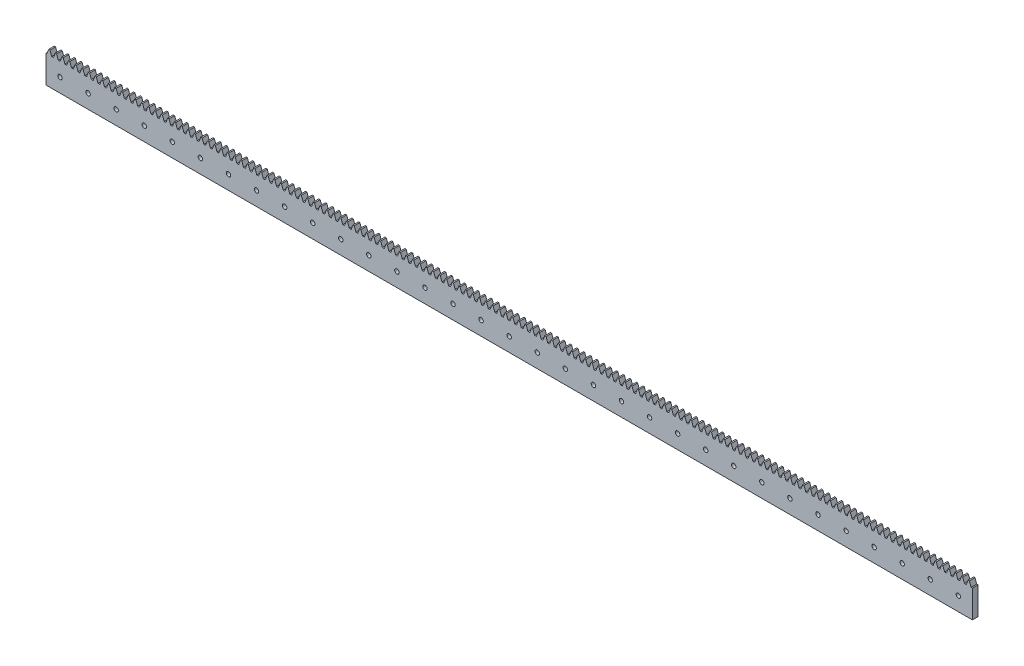
from build123d import *

# Parameters (mm, degrees)
BLANKSKE_W          = 660
BLANKSKE_H          = 23
BLANK_DEPTH         = 4
TOOTHCUTSIM_DEPTH   = 661.412749726
TEETHCUTS_COUNT     = 142
TEETHCUTS_PITCH     = 4.712388975
SKETCH_2_R          = 1.575
CUT_EXTRUDE_2_DEPTH = 661.412749726


with BuildPart() as part:
    # BlankSke → Blank (new body)
    with BuildSketch(Plane.XY):
        with Locations((330, 11.5)):
            Rectangle(BLANKSKE_W, BLANKSKE_H)
    extrude(amount=-BLANK_DEPTH)

    # TooCutSkeSim → ToothCutSim (cut, through all)
    with BuildSketch(Plane.XY):
        Polygon((0.654653055, 19.625), (-0.654653055, 19.625), (-1.892297439, 23.0254), (1.892297439, 23.0254), align=None)
    toothcutsim = extrude(amount=-TOOTHCUTSIM_DEPTH, mode=Mode.SUBTRACT)

    # TeethCuts: ToothCutSim ×142
    with Locations(*[(i * TEETHCUTS_PITCH, 0, 0) for i in range(1, TEETHCUTS_COUNT)]):
        add(toothcutsim, mode=Mode.SUBTRACT)

    # 草图2 → 切除-拉伸2 (cut, through all)
    with BuildSketch(Plane.XY):
        with Locations((650, 10)):
            Circle(SKETCH_2_R)
        with Locations((630, 10)):
            Circle(SKETCH_2_R)
        with Locations((610, 10)):
            Circle(SKETCH_2_R)
        with Locations((590, 10)):
            Circle(SKETCH_2_R)
        with Locations((570, 10)):
            Circle(SKETCH_2_R)
        with Locations((550, 10)):
            Circle(SKETCH_2_R)
        with Locations((530, 10)):
            Circle(SKETCH_2_R)
        with Locations((510, 10)):
            Circle(SKETCH_2_R)
        with Locations((490, 10)):
            Circle(SKETCH_2_R)
        with Locations((470, 10)):
            Circle(SKETCH_2_R)
        with Locations((450, 10)):
            Circle(SKETCH_2_R)
        with Locations((430, 10)):
            Circle(SKETCH_2_R)
        with Locations((410, 10)):
            Circle(SKETCH_2_R)
        with Locations((390, 10)):
            Circle(SKETCH_2_R)
        with Locations((370, 10)):
            Circle(SKETCH_2_R)
        with Locations((350, 10)):
            Circle(SKETCH_2_R)
        with Locations((330, 10)):
            Circle(SKETCH_2_R)
        with Locations((310, 10)):
            Circle(SKETCH_2_R)
        with Locations((290, 10)):
            Circle(SKETCH_2_R)
        with Locations((270, 10)):
            Circle(SKETCH_2_R)
        with Locations((250, 10)):
            Circle(SKETCH_2_R)
        with Locations((230, 10)):
            Circle(SKETCH_2_R)
        with Locations((210, 10)):
            Circle(SKETCH_2_R)
        with Locations((190, 10)):
            Circle(SKETCH_2_R)
        with Locations((170, 10)):
            Circle(SKETCH_2_R)
        with Locations((150, 10)):
            Circle(SKETCH_2_R)
        with Locations((130, 10)):
            Circle(SKETCH_2_R)
        with Locations((110, 10)):
            Circle(SKETCH_2_R)
        with Locations((90, 10)):
            Circle(SKETCH_2_R)
        with Locations((70, 10)):
            Circle(SKETCH_2_R)
        with Locations((50, 10)):
            Circle(SKETCH_2_R)
        with Locations((30, 10)):
            Circle(SKETCH_2_R)
        with Locations((10, 10)):
            Circle(SKETCH_2_R)
    extrude(amount=-CUT_EXTRUDE_2_DEPTH, mode=Mode.SUBTRACT)


solid = part.part
